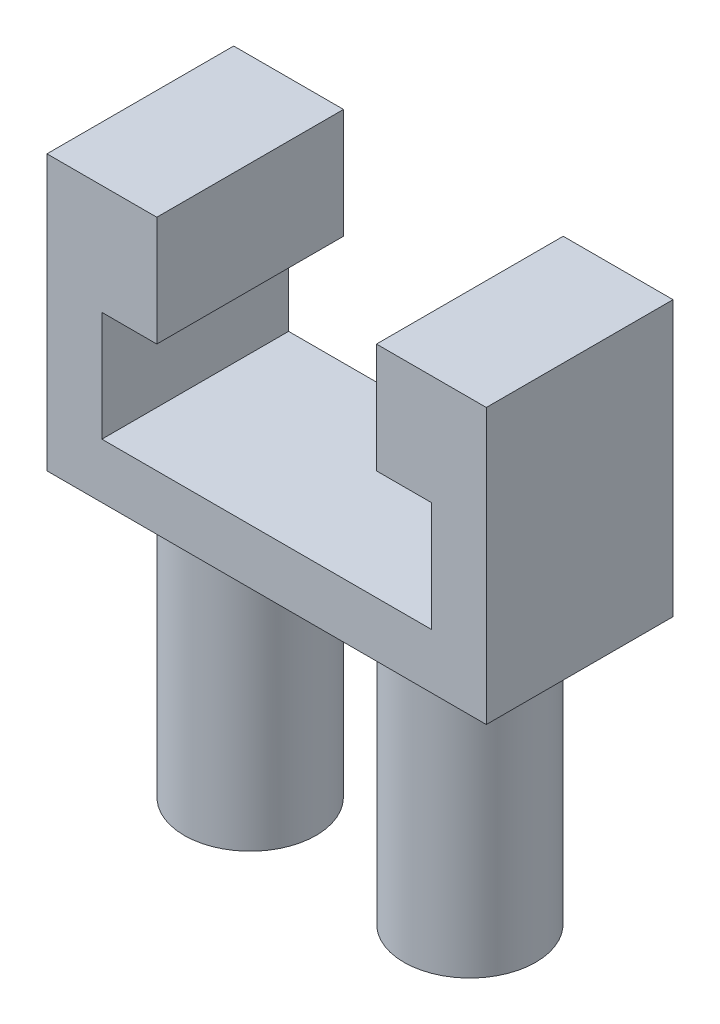
from build123d import *
from build123d.topology import SkipClean

# Parameters (mm, degrees)
SKETCH_3_W               = 32
SKETCH_3_H               = 12
EXTRUDE_3_DEPTH          = 5
SKETCH_4_R               = 5
EXTRUDE_4_DEPTH          = 10
SKETCH_8_R               = 5
EXTRUDE_6_DEPTH          = 5
SKETCH_9_R               = 4.8
CUT_EXTRUDE_2_DEPTH      = 0.5
EXTRUDE_START            = 5
SKETCH_36_R              = 5
SKETCH_36_R_2            = 4.98
EXTRUDE_11_DEPTH         = 5
SKETCH_46_W              = 32
SKETCH_46_H              = 12
EXTRUDE_12_DEPTH         = 20
SKETCH_47_W              = 4
SKETCH_47_H              = 25
EXTRUDE_13_DEPTH         = 12
SKETCH_48_W              = 4
SKETCH_48_H              = 25
EXTRUDE_14_DEPTH         = 12
CUT_EXTRUDE_5_DEPTH      = 46.44227107
CUT_EXTRUDE_5_DEPTH_BACK = 12
SKETCH_50_R              = 6
EXTRUDE_15_DEPTH         = 20
SKETCH_51_R              = 6
EXTRUDE_16_DEPTH         = 20
EXTRUDE_17_DEPTH         = 2.5
EXTRUDE_18_DEPTH         = 2.5


with BuildPart() as part:
    # 草图3 → 凸台-拉伸3 (new body)
    with BuildSketch(Plane(origin=(0, 0, 0), x_dir=(1, 0, 0), z_dir=(0, 1, 0))):
        with Locations((16, 6)):
            Rectangle(SKETCH_3_W, SKETCH_3_H)
    extrude(amount=EXTRUDE_3_DEPTH)

    # 草图4 → 凸台-拉伸4 (add)
    with BuildSketch(Plane.XZ):
        with Locations((6, -6)):
            Circle(SKETCH_4_R)
        with Locations((26, -6)):
            Circle(SKETCH_4_R)
    extrude(amount=EXTRUDE_4_DEPTH)

    # 草图8 → 凸台-拉伸6 (add)
    with BuildSketch(Plane.XZ.offset(10)):
        with Locations((6, -6)):
            Circle(SKETCH_8_R)
    extrude(amount=EXTRUDE_6_DEPTH)

    # 草图9 → 切除-拉伸2 (cut)
    with BuildSketch(Plane.XZ.offset(15)):
        with Locations((6, -6)):
            Circle(SKETCH_9_R)
    extrude(amount=-CUT_EXTRUDE_2_DEPTH, mode=Mode.SUBTRACT)



with BuildPart() as body_2:
    # 草图14 → 旋转2 (revolve)
    with BuildSketch(Plane.XY.offset(-6)):
        Polygon((1.021282046, -20), (1.221282046, -15), (1.021282046, -15), align=None)
    revolve(axis=Axis((6, -15, -6), (0, 1, 0)))


with BuildPart() as part_1:
    add(part.part)

    add(body_2.part)  # 凸台-拉伸11 merges body 2
    # 草图36 → 凸台-拉伸11 (add)
    with BuildSketch(Plane(origin=(0, -20, 0), x_dir=(1, 0, 0), z_dir=(0, 1, 0)).offset(EXTRUDE_START)):
        with Locations((6, 6)):
            Circle(SKETCH_36_R)
        with Locations((6, 6)):
            Circle(SKETCH_36_R_2, mode=Mode.SUBTRACT)
    extrude(amount=-EXTRUDE_11_DEPTH)

    # 草图46 → 凸台-拉伸12 (add)
    with BuildSketch(Plane(origin=(0, 5, 0), x_dir=(1, 0, 0), z_dir=(0, 1, 0))):
        with Locations((16, 6)):
            Rectangle(SKETCH_46_W, SKETCH_46_H)
    extrude(amount=EXTRUDE_12_DEPTH)

    # 草图47 → 凸台-拉伸13 (add)
    with BuildSketch(Plane.XY):
        with Locations((-2, 12.5)):
            Rectangle(SKETCH_47_W, SKETCH_47_H)
    extrude(amount=-EXTRUDE_13_DEPTH)

    # 草图48 → 凸台-拉伸14 (add)
    with BuildSketch(Plane.XY):
        with Locations((34, 12.5)):
            Rectangle(SKETCH_48_W, SKETCH_48_H)
    extrude(amount=-EXTRUDE_14_DEPTH)

    # 草图49 → 切除-拉伸5 (cut, two sides: drawn at the far end of the back side and taken through both)
    with BuildSketch(Plane.XY.offset(-CUT_EXTRUDE_5_DEPTH_BACK)):
        Polygon((26, 143.166538264), (26, 25), (26, 15), (31, 15), (31, 5), (1, 5), (1, 15), (6, 15), (6, 25), (6, 143.166538264), (6, 379.499614792), (26, 379.499614792), align=None)
    extrude(amount=CUT_EXTRUDE_5_DEPTH + CUT_EXTRUDE_5_DEPTH_BACK, mode=Mode.SUBTRACT)

    # 草图50 → 凸台-拉伸15 (add)
    with BuildSketch(Plane.XZ):
        with Locations((6, -6)):
            Circle(SKETCH_50_R)
    extrude(amount=EXTRUDE_15_DEPTH)

    # 草图51 → 凸台-拉伸16 (add)
    with BuildSketch(Plane.XZ):
        with Locations((26, -6)):
            Circle(SKETCH_51_R)
    extrude(amount=EXTRUDE_16_DEPTH)

    # 草图52 → 旋转3 (revolve)
    with SkipClean():  # the faces are left unmerged after this step: merging them gives an invalid solid
        with BuildSketch(Plane.XY.offset(-6)):
            Polygon((0, -20), (0, -25), (0.2, -20), align=None)
        revolve(axis=Axis((6, -20, -6), (0, -1, 0)))

    # 草图53 → 旋转4 (revolve)
    with SkipClean():  # the faces are left unmerged after this step: merging them gives an invalid solid
        with BuildSketch(Plane.XY.offset(-6)):
            Polygon((20, -20), (20, -25), (20.2, -20), align=None)
        revolve(axis=Axis((26, -20, -6), (0, -1, 0)))

    # 草图55 → 凸台-拉伸17 (add)
    with BuildSketch(Plane.XY):
        Polygon((-4, 25), (6, 25), (6, 15), (1, 15), (1, 5), (31, 5), (31, 15), (26, 15), (26, 25), (36, 25), (36, 0), (-4, 0), align=None)
    extrude(amount=EXTRUDE_17_DEPTH)

    # 草图56 → 凸台-拉伸18 (add)
    with BuildSketch(Plane(origin=(0, 0, -12), x_dir=(-1, 0, 0), z_dir=(0, 0, -1))):
        Polygon((-36, 25), (-26, 25), (-26, 15), (-31, 15), (-31, 5), (-1, 5), (-1, 15), (-6, 15), (-6, 25), (4, 25), (4, 0), (-36, 0), align=None)
    extrude(amount=EXTRUDE_18_DEPTH)


solid = part_1.part
